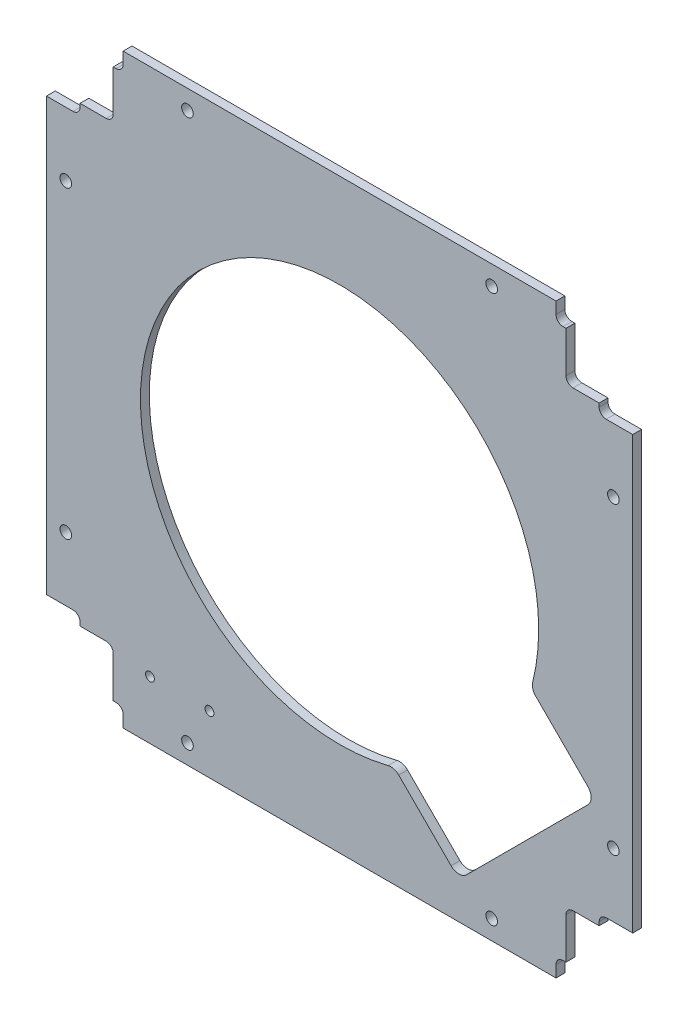
from build123d import *

# Parameters (mm, degrees)
SKETCH1_W                 = 106
SKETCH1_H                 = 106
MAINOUTLINE_DEPTH         = 1.6
SKETCH4_W                 = 11.7
SKETCH4_H                 = 11.7
RAILCUTOUTS_DEPTH         = 75.970394157
SKETCH13_W                = 5.7
SKETCH13_H                = 1.9
SKETCH13_W_2              = 1.8
SKETCH13_H_2              = 3
FILLETCUTOUTS_DEPTH       = 75.970394157
SMOOTHCORNER_DEPTH        = 10
MIRROR2_COPY_1_SKETCH_W   = 11.7
MIRROR2_COPY_1_SKETCH_H   = 11.7
MIRROR2_COPY_1_DEPTH      = 75.970394157
MIRROR2_COPY_2_SKETCH_W   = 5.7
MIRROR2_COPY_2_SKETCH_H   = 1.9
MIRROR2_COPY_2_SKETCH_W_2 = 1.8
MIRROR2_COPY_2_SKETCH_H_2 = 3
MIRROR2_COPY_2_DEPTH      = 75.970394157
MIRROR2_COPY_3_DEPTH      = 10
MIRROR2_COPY_4_SKETCH_W   = 11.7
MIRROR2_COPY_4_SKETCH_H   = 11.7
MIRROR2_COPY_4_DEPTH      = 75.970394157
MIRROR2_COPY_5_SKETCH_W   = 5.7
MIRROR2_COPY_5_SKETCH_H   = 1.9
MIRROR2_COPY_5_SKETCH_W_2 = 1.8
MIRROR2_COPY_5_SKETCH_H_2 = 3
MIRROR2_COPY_5_DEPTH      = 75.970394157
MIRROR2_COPY_6_DEPTH      = 10
M2_CLEARANCE_HOLE1_D      = 2.1
SKETCH15_W                = 90
SKETCH15_H                = 6.2
SKETCH15_W_2              = 5.2
SKETCH15_H_2              = 90
CUT_EXTRUDE5_DEPTH        = 0.001
CUT_EXTRUDE2_DEPTH        = 75.970394157
CUT_EXTRUDE2_DEPTH_BACK   = 75.970394157
SKETCH11_R                = 36
CUT_EXTRUDE7_DEPTH        = 10
FILLET11_R                = 2
SKETCH29_R                = 0.8
CONNECTOR_LOCATION_DEPTH  = 10


with BuildPart() as part:
    # Sketch1 → mainOutline (new body)
    with BuildSketch(Plane.XY):
        Rectangle(SKETCH1_W, SKETCH1_H)
    extrude(amount=MAINOUTLINE_DEPTH)

    # Sketch4 → railCutouts (cut, through all)
    with BuildSketch(Plane(origin=(0, 0, 0), x_dir=(-1, 0, 0), z_dir=(0, 0, -1))):
        with Locations((47.15, 47.15)):
            Rectangle(SKETCH4_W, SKETCH4_H)
    railcutouts = extrude(amount=-RAILCUTOUTS_DEPTH, mode=Mode.SUBTRACT)

    # Sketch13 → filletCutouts (cut, symmetric)
    with BuildSketch(Plane(origin=(0, 0, 0), x_dir=(-1, 0, 0), z_dir=(0, 0, -1))):
        with Locations((50.15, 40.35)):
            Rectangle(SKETCH13_W, SKETCH13_H)
        with Locations((40.4, 51.5)):
            Rectangle(SKETCH13_W_2, SKETCH13_H_2)
    filletcutouts = extrude(amount=FILLETCUTOUTS_DEPTH, both=True, mode=Mode.SUBTRACT)

    # Sketch27 → smoothCorner (cut)
    with BuildSketch(Plane.XY.offset(1.6)):
        with BuildLine():
            Line((-40.928025612, 42.198025612), (-40.928025612, 49.628025612))
            Line((-40.928025612, 49.628025612), (-40.398025612, 49.628025612))
            ThreePointArc((-40.398025612, 49.628025612), (-39.5, 50), (-39.128025612, 50.898025612))
            Line((-39.128025612, 50.898025612), (-39.128025612, 53))
            Line((-39.128025612, 53), (-53, 53))
            Line((-53, 53), (-53, 39.028025612))
            Line((-53, 39.028025612), (-48.198025612, 39.028025612))
            ThreePointArc((-48.198025612, 39.028025612), (-47.3, 39.4), (-46.928025612, 40.298025612))
            Line((-46.928025612, 40.298025612), (-46.928025612, 40.928025612))
            Line((-46.928025612, 40.928025612), (-42.198025612, 40.928025612))
            ThreePointArc((-42.198025612, 40.928025612), (-41.3, 41.3), (-40.928025612, 42.198025612))
        make_face()
    smoothcorner = extrude(amount=-SMOOTHCORNER_DEPTH, mode=Mode.SUBTRACT)

    # Mirror1: railCutouts, filletCutouts, smoothCorner across plane
    add(railcutouts.mirror(Plane(origin=(0, 0, 0), x_dir=(0, 0, 1), z_dir=(1, 0, 0))), mode=Mode.SUBTRACT)
    add(filletcutouts.mirror(Plane(origin=(0, 0, 0), x_dir=(0, 0, 1), z_dir=(1, 0, 0))), mode=Mode.SUBTRACT)
    add(smoothcorner.mirror(Plane(origin=(0, 0, 0), x_dir=(0, 0, 1), z_dir=(1, 0, 0))), mode=Mode.SUBTRACT)

    # Mirror2 copy 1 sketch → Mirror2 copy 1 (cut, through all)
    with BuildSketch(Plane(origin=(0, 0, 0), x_dir=(1, 0, 0), z_dir=(0, 0, -1))):
        with Locations((47.15, 47.15)):
            Rectangle(MIRROR2_COPY_1_SKETCH_W, MIRROR2_COPY_1_SKETCH_H)
    extrude(amount=-MIRROR2_COPY_1_DEPTH, mode=Mode.SUBTRACT)

    # Mirror2 copy 2 sketch → Mirror2 copy 2 (cut, symmetric)
    with BuildSketch(Plane(origin=(0, 0, 0), x_dir=(1, 0, 0), z_dir=(0, 0, -1))):
        with Locations((50.15, 40.35)):
            Rectangle(MIRROR2_COPY_2_SKETCH_W, MIRROR2_COPY_2_SKETCH_H)
        with Locations((40.4, 51.5)):
            Rectangle(MIRROR2_COPY_2_SKETCH_W_2, MIRROR2_COPY_2_SKETCH_H_2)
    extrude(amount=MIRROR2_COPY_2_DEPTH, both=True, mode=Mode.SUBTRACT)

    # Mirror2 copy 3 sketch → Mirror2 copy 3 (cut)
    with BuildSketch(Plane(origin=(0, 0, 1.6), x_dir=(-1, 0, 0), z_dir=(0, 0, 1))):
        with BuildLine():
            Line((-40.928025612, 42.198025612), (-40.928025612, 49.628025612))
            Line((-40.928025612, 49.628025612), (-40.398025612, 49.628025612))
            ThreePointArc((-40.398025612, 49.628025612), (-39.5, 50), (-39.128025612, 50.898025612))
            Line((-39.128025612, 50.898025612), (-39.128025612, 53))
            Line((-39.128025612, 53), (-53, 53))
            Line((-53, 53), (-53, 39.028025612))
            Line((-53, 39.028025612), (-48.198025612, 39.028025612))
            ThreePointArc((-48.198025612, 39.028025612), (-47.3, 39.4), (-46.928025612, 40.298025612))
            Line((-46.928025612, 40.298025612), (-46.928025612, 40.928025612))
            Line((-46.928025612, 40.928025612), (-42.198025612, 40.928025612))
            ThreePointArc((-42.198025612, 40.928025612), (-41.3, 41.3), (-40.928025612, 42.198025612))
        make_face()
    extrude(amount=-MIRROR2_COPY_3_DEPTH, mode=Mode.SUBTRACT)

    # Mirror2 copy 4 sketch → Mirror2 copy 4 (cut, through all)
    with BuildSketch(Plane(origin=(0, 0, 0), x_dir=(-1, 0, 0), z_dir=(0, 0, -1))):
        with Locations((47.15, -47.15)):
            Rectangle(MIRROR2_COPY_4_SKETCH_W, MIRROR2_COPY_4_SKETCH_H)
    extrude(amount=-MIRROR2_COPY_4_DEPTH, mode=Mode.SUBTRACT)

    # Mirror2 copy 5 sketch → Mirror2 copy 5 (cut, symmetric)
    with BuildSketch(Plane(origin=(0, 0, 0), x_dir=(-1, 0, 0), z_dir=(0, 0, -1))):
        with Locations((50.15, -40.35)):
            Rectangle(MIRROR2_COPY_5_SKETCH_W, MIRROR2_COPY_5_SKETCH_H)
        with Locations((40.4, -51.5)):
            Rectangle(MIRROR2_COPY_5_SKETCH_W_2, MIRROR2_COPY_5_SKETCH_H_2)
    extrude(amount=MIRROR2_COPY_5_DEPTH, both=True, mode=Mode.SUBTRACT)

    # Mirror2 copy 6 sketch → Mirror2 copy 6 (cut)
    with BuildSketch(Plane.XY.offset(1.6)):
        with BuildLine():
            Line((-40.928025612, -42.198025612), (-40.928025612, -49.628025612))
            Line((-40.928025612, -49.628025612), (-40.398025612, -49.628025612))
            ThreePointArc((-40.398025612, -49.628025612), (-39.5, -50), (-39.128025612, -50.898025612))
            Line((-39.128025612, -50.898025612), (-39.128025612, -53))
            Line((-39.128025612, -53), (-53, -53))
            Line((-53, -53), (-53, -39.028025612))
            Line((-53, -39.028025612), (-48.198025612, -39.028025612))
            ThreePointArc((-48.198025612, -39.028025612), (-47.3, -39.4), (-46.928025612, -40.298025612))
            Line((-46.928025612, -40.298025612), (-46.928025612, -40.928025612))
            Line((-46.928025612, -40.928025612), (-42.198025612, -40.928025612))
            ThreePointArc((-42.198025612, -40.928025612), (-41.3, -41.3), (-40.928025612, -42.198025612))
        make_face()
    extrude(amount=-MIRROR2_COPY_6_DEPTH, mode=Mode.SUBTRACT)

    # M2 Clearance Hole1 (through all)
    with Locations(Plane(origin=(0, 0, 0), x_dir=(-1, 0, 0), z_dir=(0, 0, -1))):
        with Locations((49.5, -27.5), (27.5, -49.5), (-49.5, -27.5), (-27.5, -49.5), (-27.5, 49.5), (-49.5, 27.5), (27.5, 49.5), (49.5, 27.5)):
            Hole(M2_CLEARANCE_HOLE1_D / 2)

    # Sketch15 → Cut-Extrude5 (cut)
    with BuildSketch(Plane(origin=(0, 0, 0), x_dir=(-1, 0, 0), z_dir=(0, 0, -1))):
        with Locations((0, 49.9)):
            Rectangle(SKETCH15_W, SKETCH15_H)
        with Locations((0, -49.9)):
            Rectangle(SKETCH15_W, SKETCH15_H)
        with Locations((-50.4, 0)):
            Rectangle(SKETCH15_W_2, SKETCH15_H_2)
        with Locations((50.4, 0)):
            Rectangle(SKETCH15_W_2, SKETCH15_H_2)
    extrude(amount=-CUT_EXTRUDE5_DEPTH, mode=Mode.SUBTRACT)

    # Sketch11 → Cut-Extrude2 (cut, two sides: drawn at the far end of the back side and taken through both)
    with BuildSketch(Plane(origin=(0, 0, 0), x_dir=(-1, 0, 0), z_dir=(0, 0, -1)).offset(-CUT_EXTRUDE2_DEPTH_BACK)):
        Circle(SKETCH11_R)
    extrude(amount=CUT_EXTRUDE2_DEPTH + CUT_EXTRUDE2_DEPTH_BACK, mode=Mode.SUBTRACT)

    # Sketch28 → Cut-Extrude7 (cut)
    with BuildSketch(Plane(origin=(0, 0, 0), x_dir=(-1, 0, 0), z_dir=(0, 0, -1))):
        Polygon((-12.374368671, 12.374368671), (-46.315494168, -21.566756826), (-21.566756826, -46.315494168), (12.374368671, -12.374368671), align=None)
    extrude(amount=-CUT_EXTRUDE7_DEPTH, mode=Mode.SUBTRACT)

    # Fillet11
    fillet11_edges = [part.edges().sort_by_distance(p)[0] for p in [
        (21.566756826, -46.315494168, 0.8),
        (9.871417447, -34.620154789, 0.8),
        (34.620154789, -9.871417447, 0.8),
        (46.315494168, -21.566756826, 0.8),
    ]]
    fillet(fillet11_edges, radius=FILLET11_R)

    # Sketch29 → Connector Location (cut)
    with BuildSketch(Plane(origin=(0, 0, 0), x_dir=(-1, 0, 0), z_dir=(0, 0, -1))):
        with Locations((34.285, -42.5)):
            Circle(SKETCH29_R)
        with Locations((23.515, -42.5)):
            Circle(SKETCH29_R)
    extrude(amount=-CONNECTOR_LOCATION_DEPTH, mode=Mode.SUBTRACT)


solid = part.part
